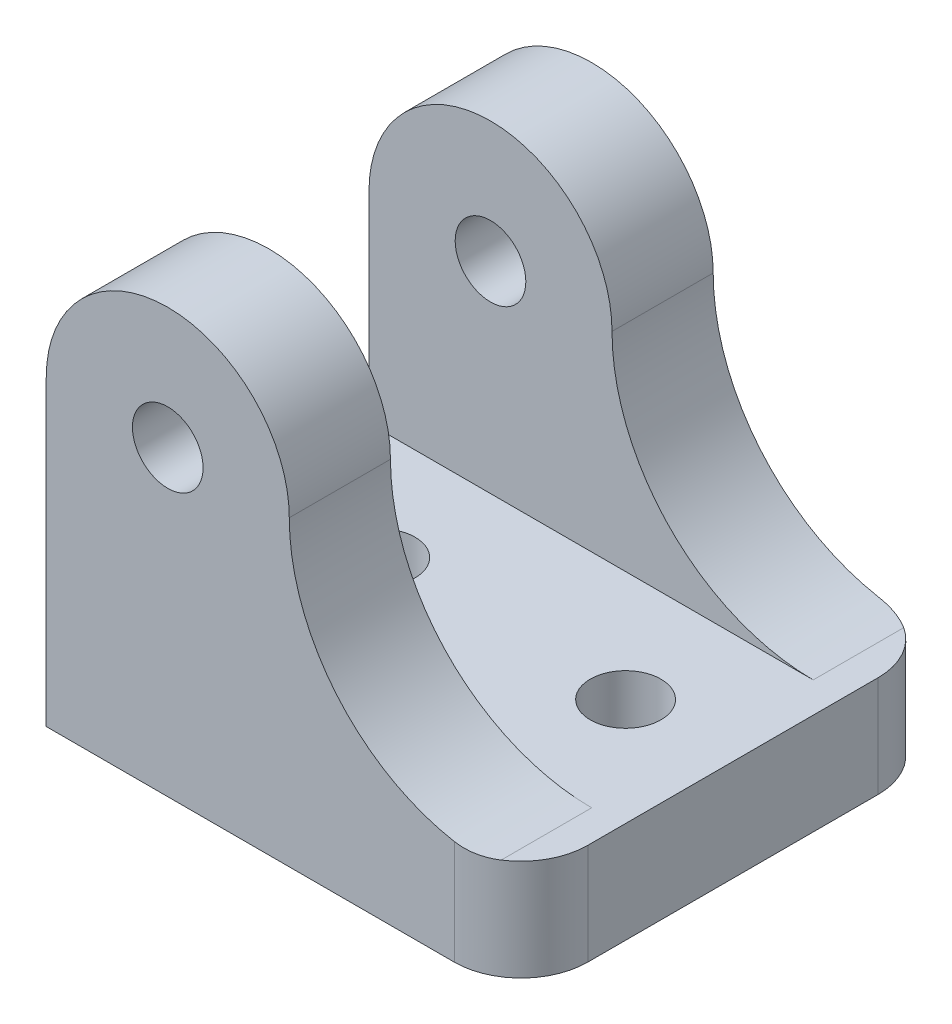
from build123d import *

# Parameters (mm, degrees)
SKETCH1_W              = 42.672
SKETCH1_H              = 38.1
BOSS_EXTRUDE1_DEPTH    = 38.1
SKETCH3_R              = 3.175
CUT_EXTRUDE1_DEPTH     = 69.732231042
FILLET1_R              = 6
SPLIT1_START           = -38.1
SPLIT1_OUTLINE_R       = 3.175
SPLIT1_DEPTH           = 38.1
SPLIT2_SURFACE_1_BACK  = 69.732
SPLIT2_SURFACE_1_DEPTH = 139.464


# Read off the part's stored shape, not the designer's step: Split1
with BuildPart() as part:
    # Sketch1 → Boss-Extrude1 (new body)
    with BuildSketch(Plane(origin=(0, 0, 0), x_dir=(1, 0, 0), z_dir=(0, 1, 0))):
        with Locations((21.336, 19.05)):
            Rectangle(SKETCH1_W, SKETCH1_H)
    extrude(amount=BOSS_EXTRUDE1_DEPTH)

    # Sketch3 → Cut-Extrude1 (cut, through all)
    with BuildSketch(Plane(origin=(0, 0, 0), x_dir=(1, 0, 0), z_dir=(0, 1, 0))):
        with Locations(Location((10.922, 19.05, 0), (0, 0, 90))):
            Circle(SKETCH3_R)
        with Locations(Location((33.02, 19.05, 0), (0, 0, 90))):
            Circle(SKETCH3_R)
    extrude(amount=CUT_EXTRUDE1_DEPTH, mode=Mode.SUBTRACT)

    # Fillet1
    fillet1_edges = [part.edges().sort_by_distance(p)[0] for p in [
        (42.672, 19.05, -38.1),
        (42.672, 19.05, 0),
    ]]
    fillet(fillet1_edges, radius=FILLET1_R)

    # Split1 outline → Split1 (cut)
    with BuildSketch(Plane.XY.offset(SPLIT1_START)):
        with Locations((10.922, 27.178)):
            Circle(SPLIT1_OUTLINE_R)
        with BuildLine():
            ThreePointArc((21.844, 27.178), (27.140915284, 14.390115284), (39.9288, 9.0932))
            Line((39.9288, 9.0932), (42.672, 9.0932))
            Line((42.672, 9.0932), (42.672, 38.1))
            Line((42.672, 38.1), (10.922, 38.1))
            ThreePointArc((10.922, 38.1), (18.645020264, 34.901020264), (21.844, 27.178))
        make_face()
        with BuildLine():
            ThreePointArc((0, 27.178), (3.198979736, 34.901020264), (10.922, 38.1))
            Line((10.922, 38.1), (0, 38.1))
            Line((0, 38.1), (0, 27.178))
        make_face()
    extrude(amount=SPLIT1_DEPTH, mode=Mode.SUBTRACT)

    # Split2: cut with a surface, the side behind it stays
    # Split2 surface: a surface, the sketch's curves swept straight by 139.464 mm
    with BuildLine(Plane(origin=(42.672, 0, 0), x_dir=(0, 0, -1), z_dir=(1, 0, 0)).offset(-SPLIT2_SURFACE_1_BACK), mode=Mode.PRIVATE) as split2_surface_1_path:
        Line((9.0932, 38.1), (9.0932, 9.0932))
        Line((9.0932, 9.0932), (29.0068, 9.0932))
        Line((29.0068, 9.0932), (29.0068, 38.1))
    split2_surface_1 = Shell.extrude(split2_surface_1_path.wire(), (1 * SPLIT2_SURFACE_1_DEPTH, 0 * SPLIT2_SURFACE_1_DEPTH, 0 * SPLIT2_SURFACE_1_DEPTH))
    split(bisect_by=split2_surface_1, keep=Keep.BOTTOM)


solid = part.part
